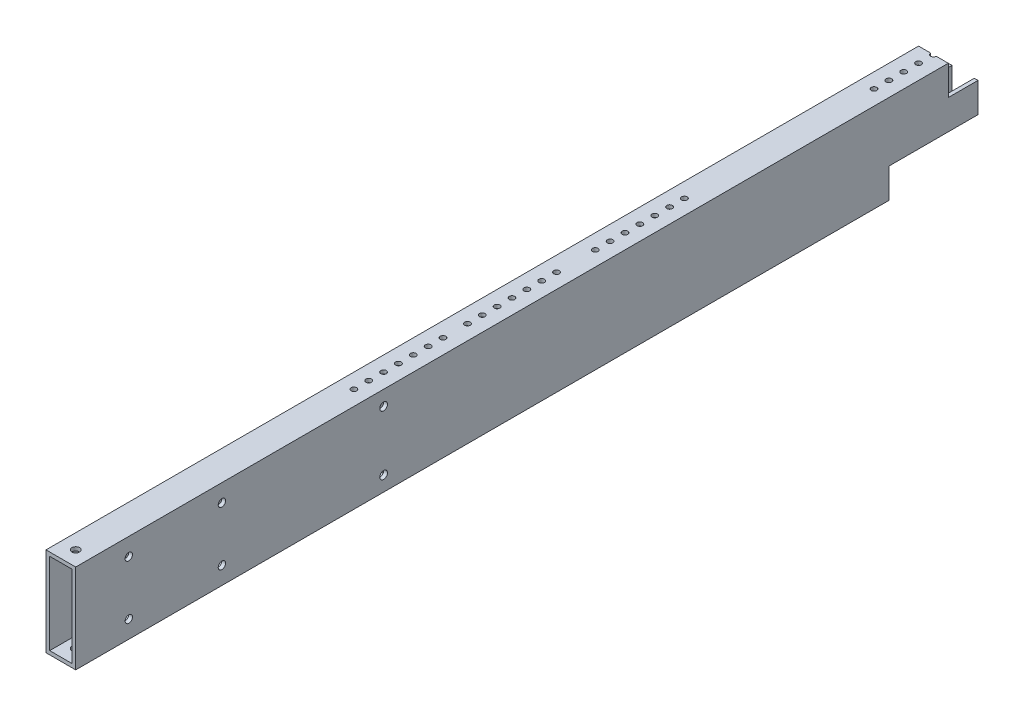
from build123d import *

# Parameters (mm, degrees)
SKETCH1_W                               = 25.4
SKETCH1_H                               = 76.2
BOSS_EXTRUDE1_DEPTH                     = 385.699
SHELL1_T                                = -3.175
SKETCH2_W                               = 76.2
SKETCH2_H                               = 25.4
CUT_EXTRUDE1_DEPTH                      = 389.407632007
SKETCH3_W                               = 25.4
SKETCH3_H                               = 25.4
CUT_EXTRUDE2_DEPTH                      = 389.407632007
SKETCH4_R                               = 2.38125
CUT_EXTRUDE3_DEPTH                      = 394.359185225
CUT_EXTRUDE4_REACH                      = 395.359
SKETCH5_R                               = 2.38125
CUT_EXTRUDE5_REACH                      = 395.359
SKETCH6_R                               = 2.38125
CBORE_FOR_M6_HEX_HEAD_BOLT1_D           = 6.3
CBORE_FOR_M6_HEX_HEAD_BOLT1_CBORE_D     = 14.547
CBORE_FOR_M6_HEX_HEAD_BOLT1_CBORE_DEPTH = 4
M6_CLEARANCE_HOLE1_D                    = 6.6
M6_CLEARANCE_HOLE2_D                    = 6.6


with BuildPart() as part:
    # Sketch1 → Boss-Extrude1 (new, symmetric)
    with BuildSketch(Plane.XY):
        Rectangle(SKETCH1_W, SKETCH1_H)
    extrude(amount=BOSS_EXTRUDE1_DEPTH, both=True)

    # Shell1
    shell1_openings = [part.faces().sort_by_distance(p)[0] for p in [
        (0, 0, -385.699),
        (0, 0, 385.699),
    ]]
    offset(amount=SHELL1_T, openings=shell1_openings, kind=Kind.INTERSECTION)

    # Sketch2 → Cut-Extrude1 (cut, through all)
    with BuildSketch(Plane(origin=(12.7, 0, 0), x_dir=(0, 0, -1), z_dir=(1, 0, 0))):
        with Locations((347.599, -25.4)):
            Rectangle(SKETCH2_W, SKETCH2_H)
    extrude(amount=-CUT_EXTRUDE1_DEPTH, mode=Mode.SUBTRACT)

    # Sketch3 → Cut-Extrude2 (cut, through all)
    with BuildSketch(Plane(origin=(12.7, 0, 0), x_dir=(0, 0, -1), z_dir=(1, 0, 0))):
        with Locations((372.999, 25.4)):
            Rectangle(SKETCH3_W, SKETCH3_H)
    extrude(amount=-CUT_EXTRUDE2_DEPTH, mode=Mode.SUBTRACT)

    # Sketch4 → Cut-Extrude3 (cut, through all)
    with BuildSketch(Plane(origin=(0, 38.1, 0), x_dir=(1, 0, 0), z_dir=(0, 1, 0))):
        with Locations((0, 147.394483214)):
            Circle(SKETCH4_R)
        with Locations((0, 134.694483214)):
            Circle(SKETCH4_R)
        with Locations((0, 121.994483214)):
            Circle(SKETCH4_R)
        with Locations((0, 109.294483214)):
            Circle(SKETCH4_R)
        with Locations((0, 96.594483214)):
            Circle(SKETCH4_R)
        with Locations((0, 83.894483214)):
            Circle(SKETCH4_R)
        with Locations((0, 71.194483214)):
            Circle(SKETCH4_R)
        with Locations((0, 38.09873)):
            Circle(SKETCH4_R)
        with Locations((0, 25.39873)):
            Circle(SKETCH4_R)
        with Locations((0, 12.69873)):
            Circle(SKETCH4_R)
        with Locations((0, -0.00127)):
            Circle(SKETCH4_R)
        with Locations((0, -12.70127)):
            Circle(SKETCH4_R)
        with Locations((0, -25.40127)):
            Circle(SKETCH4_R)
        with Locations((0, -38.10127)):
            Circle(SKETCH4_R)
        with Locations((0, -58.99324371)):
            Circle(SKETCH4_R)
        with Locations((0, -71.69324371)):
            Circle(SKETCH4_R)
        with Locations((0, -84.39324371)):
            Circle(SKETCH4_R)
        with Locations((0, -97.09324371)):
            Circle(SKETCH4_R)
        with Locations((0, -109.79324371)):
            Circle(SKETCH4_R)
        with Locations((0, -122.49324371)):
            Circle(SKETCH4_R)
        with Locations((0, -135.19324371)):
            Circle(SKETCH4_R)
    extrude(amount=-CUT_EXTRUDE3_DEPTH, mode=Mode.SUBTRACT)

    # Sketch5 → Cut-Extrude4 (cut, up to next)
    with BuildSketch(Plane(origin=(0, 38.1, 0), x_dir=(1, 0, 0), z_dir=(0, 1, 0)), mode=Mode.PRIVATE) as cut_extrude4_sk1:
        with Locations((0, 360.299)):
            Circle(SKETCH5_R)
    cut_extrude4_tool1 = extrude(cut_extrude4_sk1.sketch, amount=-CUT_EXTRUDE4_REACH, mode=Mode.PRIVATE) & part.part
    # Sketch5 → Cut-Extrude4 (cut, up to next)
    with BuildSketch(Plane(origin=(0, 38.1, 0), x_dir=(1, 0, 0), z_dir=(0, 1, 0)), mode=Mode.PRIVATE) as cut_extrude4_sk2:
        with Locations((0, 347.599)):
            Circle(SKETCH5_R)
    cut_extrude4_tool2 = extrude(cut_extrude4_sk2.sketch, amount=-CUT_EXTRUDE4_REACH, mode=Mode.PRIVATE) & part.part
    # Sketch5 → Cut-Extrude4 (cut, up to next)
    with BuildSketch(Plane(origin=(0, 38.1, 0), x_dir=(1, 0, 0), z_dir=(0, 1, 0)), mode=Mode.PRIVATE) as cut_extrude4_sk3:
        with Locations((0, 334.899)):
            Circle(SKETCH5_R)
    cut_extrude4_tool3 = extrude(cut_extrude4_sk3.sketch, amount=-CUT_EXTRUDE4_REACH, mode=Mode.PRIVATE) & part.part
    # Sketch5 → Cut-Extrude4 (cut, up to next)
    with BuildSketch(Plane(origin=(0, 38.1, 0), x_dir=(1, 0, 0), z_dir=(0, 1, 0)), mode=Mode.PRIVATE) as cut_extrude4_sk4:
        with Locations((0, 322.199)):
            Circle(SKETCH5_R)
    cut_extrude4_tool4 = extrude(cut_extrude4_sk4.sketch, amount=-CUT_EXTRUDE4_REACH, mode=Mode.PRIVATE) & part.part
    # Sketch5 → Cut-Extrude4 (cut, up to next)
    with BuildSketch(Plane(origin=(0, 38.1, 0), x_dir=(1, 0, 0), z_dir=(0, 1, 0)), mode=Mode.PRIVATE) as cut_extrude4_sk5:
        with Locations((0, 309.499)):
            Circle(SKETCH5_R)
    cut_extrude4_tool5 = extrude(cut_extrude4_sk5.sketch, amount=-CUT_EXTRUDE4_REACH, mode=Mode.PRIVATE) & part.part
    add(cut_extrude4_tool1.solids().sort_by_distance((0, 38.1, -360.299))[0], mode=Mode.SUBTRACT)
    add(cut_extrude4_tool2.solids().sort_by_distance((0, 38.1, -347.599))[0], mode=Mode.SUBTRACT)
    add(cut_extrude4_tool3.solids().sort_by_distance((0, 38.1, -334.899))[0], mode=Mode.SUBTRACT)
    add(cut_extrude4_tool4.solids().sort_by_distance((0, 38.1, -322.199))[0], mode=Mode.SUBTRACT)
    add(cut_extrude4_tool5.solids().sort_by_distance((0, 38.1, -309.499))[0], mode=Mode.SUBTRACT)

    # Sketch6 → Cut-Extrude5 (cut, up to next)
    with BuildSketch(Plane.XZ.offset(38.1), mode=Mode.PRIVATE) as cut_extrude5_sk1:
        with Locations((0, -309.499)):
            Circle(SKETCH6_R)
    cut_extrude5_tool1 = extrude(cut_extrude5_sk1.sketch, amount=-CUT_EXTRUDE5_REACH, mode=Mode.PRIVATE) & part.part
    # Sketch6 → Cut-Extrude5 (cut, up to next)
    with BuildSketch(Plane.XZ.offset(38.1), mode=Mode.PRIVATE) as cut_extrude5_sk2:
        with Locations((0, -296.799)):
            Circle(SKETCH6_R)
    cut_extrude5_tool2 = extrude(cut_extrude5_sk2.sketch, amount=-CUT_EXTRUDE5_REACH, mode=Mode.PRIVATE) & part.part
    # Sketch6 → Cut-Extrude5 (cut, up to next)
    with BuildSketch(Plane.XZ.offset(38.1), mode=Mode.PRIVATE) as cut_extrude5_sk3:
        with Locations((0, -284.099)):
            Circle(SKETCH6_R)
    cut_extrude5_tool3 = extrude(cut_extrude5_sk3.sketch, amount=-CUT_EXTRUDE5_REACH, mode=Mode.PRIVATE) & part.part
    # Sketch6 → Cut-Extrude5 (cut, up to next)
    with BuildSketch(Plane.XZ.offset(38.1), mode=Mode.PRIVATE) as cut_extrude5_sk4:
        with Locations((0, -258.699)):
            Circle(SKETCH6_R)
    cut_extrude5_tool4 = extrude(cut_extrude5_sk4.sketch, amount=-CUT_EXTRUDE5_REACH, mode=Mode.PRIVATE) & part.part
    # Sketch6 → Cut-Extrude5 (cut, up to next)
    with BuildSketch(Plane.XZ.offset(38.1), mode=Mode.PRIVATE) as cut_extrude5_sk5:
        with Locations((0, -271.399)):
            Circle(SKETCH6_R)
    cut_extrude5_tool5 = extrude(cut_extrude5_sk5.sketch, amount=-CUT_EXTRUDE5_REACH, mode=Mode.PRIVATE) & part.part
    add(cut_extrude5_tool1.solids().sort_by_distance((0, -38.1, -309.499))[0], mode=Mode.SUBTRACT)
    add(cut_extrude5_tool2.solids().sort_by_distance((0, -38.1, -296.799))[0], mode=Mode.SUBTRACT)
    add(cut_extrude5_tool3.solids().sort_by_distance((0, -38.1, -284.099))[0], mode=Mode.SUBTRACT)
    add(cut_extrude5_tool4.solids().sort_by_distance((0, -38.1, -258.699))[0], mode=Mode.SUBTRACT)
    add(cut_extrude5_tool5.solids().sort_by_distance((0, -38.1, -271.399))[0], mode=Mode.SUBTRACT)

    # CBORE for M6 Hex Head Bolt1 (through all)
    with Locations(Plane.ZY.offset(12.7)):
        with Locations((260.7244, 23.1254), (260.7244, -23.1), (340.3244, 23.1254), (340.3244, -23.1)):
            CounterBoreHole(CBORE_FOR_M6_HEX_HEAD_BOLT1_D / 2, CBORE_FOR_M6_HEX_HEAD_BOLT1_CBORE_D / 2, CBORE_FOR_M6_HEX_HEAD_BOLT1_CBORE_DEPTH)

    # M6 Clearance Hole1 (through all)
    with Locations(Plane.ZY.offset(12.7)):
        with Locations((122.46784244, 25.4), (122.46784244, -25.4)):
            Hole(M6_CLEARANCE_HOLE1_D / 2)

    # M6 Clearance Hole2 (through all)
    with Locations(Plane(origin=(0, -38.1, 0), x_dir=(-1, 0, 0), z_dir=(0, -1, 0))):
        with Locations((0, -372.999)):
            Hole(M6_CLEARANCE_HOLE2_D / 2)


solid = part.part
